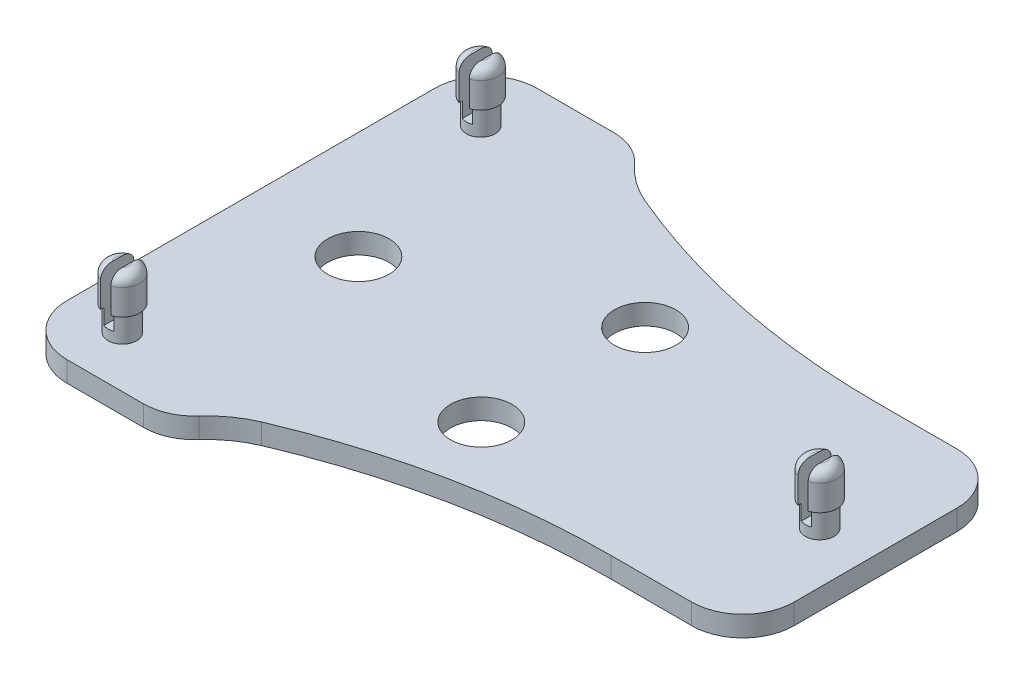
from build123d import *

# Parameters (mm, degrees)
SKETCH1_R           = 1.6
BOSS_EXTRUDE1_DEPTH = 2
FILLET1_R           = 10
FILLET2_R           = 5
SKETCH5_R           = 1.4
BOSS_EXTRUDE6_DEPTH = 6
SKETCH6_R           = 1.7
BOSS_EXTRUDE7_DEPTH = 3.5
FILLET4_R           = 1
FILLET5_R           = 1
SKETCH7_W           = 1
SKETCH7_H           = 5.450379062
SKETCH7_H_2         = 4.683162202
SKETCH7_H_3         = 5.865757262
CUT_EXTRUDE3_DEPTH  = 5
SKETCH8_R           = 1.6
BOSS_EXTRUDE8_DEPTH = 2
SKETCH10_R          = 3
CUT_EXTRUDE4_DEPTH  = 10


with BuildPart() as part:
    # Sketch1 → Boss-Extrude1 (new body)
    with BuildSketch(Plane(origin=(0, 0, 0), x_dir=(1, 0, 0), z_dir=(0, 1, 0))):
        with BuildLine():
            Line((-30.5, -22.95), (-30.5, 22.95))
            Line((-30.5, 22.95), (-15.5, 22.95))
            Line((-15.5, 22.95), (-15.5, 20.95))
            ThreePointArc((-15.5, 20.95), (0.582186133, 14.978356094), (17.616945107, 12.95))
            Line((17.616945107, 12.95), (30.5, 12.95))
            Line((30.5, 12.95), (30.5, -12.95))
            Line((30.5, -12.95), (17.616945107, -12.95))
            ThreePointArc((17.616945107, -12.95), (0.582186133, -14.978356094), (-15.5, -20.95))
            Line((-15.5, -20.95), (-15.5, -22.95))
            Line((-15.5, -22.95), (-30.5, -22.95))
        make_face()
        with Locations(Location((25.5, -0.45, 0), (0, 0, 270))):
            Circle(SKETCH1_R, mode=Mode.SUBTRACT)
    extrude(amount=BOSS_EXTRUDE1_DEPTH)

    # Fillet1
    # the kernel refuses this fillet: 10 mm, written as the material it adds along each edge
    with BuildSketch(Plane(origin=(-15.5, 0, 20.95), x_dir=(0, 0, 1), z_dir=(0, 1, 0))) as fillet1_piece_1:
        with BuildLine():
            CenterArc((6.973239904, 8.675648959), FILLET1_R, 203.002710251, 37.174175757)
            Line((-2.231623793, 4.767902254), (-2.415721067, 4.68974732))
            ThreePointArc((-2.415721067, 4.68974732), (-1.340214661, 2.278919077), (-0.177944953, -0.091299473))
            Line((-0.177944953, -0.091299473), (0, -0.2))
            ThreePointArc((0, -0.2), (1, -0.2), (1.900535202, -0.173512979))
            Line((1.900535202, -0.173512979), (2, 0))
        make_face()
    extrude(amount=2)
    with BuildSketch(Plane(origin=(-15.5, 0, -20.95), x_dir=(0, 0, -1), z_dir=(0, 1, 0))) as fillet1_piece_2:
        with BuildLine():
            CenterArc((6.973239904, -8.675648959), FILLET1_R, 119.823113992, 37.174175757)
            Line((-2.231623793, -4.767902254), (-2.415721067, -4.68974732))
            ThreePointArc((-2.415721067, -4.68974732), (-1.340214661, -2.278919077), (-0.177944953, 0.091299473))
            Line((-0.177944953, 0.091299473), (0, 0.2))
            ThreePointArc((0, 0.2), (1, 0.2), (1.900535202, 0.173512979))
            Line((1.900535202, 0.173512979), (2, 0))
        make_face()
    extrude(amount=2)

    # Fillet2
    fillet2_edges = [part.edges().sort_by_distance(p)[0] for p in [
        (-30.5, 1, 22.95),
        (-30.5, 1, -22.95),
        (-15.5, 1, -22.95),
        (30.5, 1, -12.95),
        (30.5, 1, 12.95),
        (-15.5, 1, 22.95),
    ]]
    fillet(fillet2_edges, radius=FILLET2_R)

    # Sketch5 → Boss-Extrude6 (add)
    with BuildSketch(Plane(origin=(0, 2, 0), x_dir=(1, 0, 0), z_dir=(0, 1, 0))):
        with Locations(Location((-25.1, 17.05, 0), (0, 0, 270))):
            Circle(SKETCH5_R)
        with Locations(Location((-25.1, -17.95, 0), (0, 0, 270))):
            Circle(SKETCH5_R)
        with Locations(Location((25.5, -0.45, 0), (0, 0, 270))):
            Circle(SKETCH5_R)
    extrude(amount=BOSS_EXTRUDE6_DEPTH)


with BuildPart() as boss_extrude6_piece_1:
    # of the separate pieces the step leaves, piece 1, a body of its own (boss_extrude6_pieces)
    add(part.part.solids().sort_by_distance((-14.293829256, 0, -21.274413301))[0])



with BuildPart() as boss_extrude6_piece_2:
    # of the separate pieces the step leaves, piece 2, a body of its own (boss_extrude6_pieces)
    add(part.part.solids().sort_by_distance((25.5, 2, 1.85))[0])


with BuildPart() as boss_extrude6_piece_1_1:
    add(boss_extrude6_piece_1.part)

    add(boss_extrude6_piece_2.part)  # Boss-Extrude7 merges Boss-Extrude6 piece 2
    # Sketch6 → Boss-Extrude7 (add)
    with BuildSketch(Plane(origin=(0, 8, 0), x_dir=(1, 0, 0), z_dir=(0, 1, 0))):
        with Locations(Location((-25.1, 17.05, 0), (0, 0, 270))):
            Circle(SKETCH6_R)
        with Locations(Location((25.5, -0.45, 0), (0, 0, 270))):
            Circle(SKETCH6_R)
        with Locations(Location((-25.1, -17.95, 0), (0, 0, 270))):
            Circle(SKETCH6_R)
    extrude(amount=-BOSS_EXTRUDE7_DEPTH)

    # Fillet4
    fillet4_edges = [boss_extrude6_piece_1_1.edges().sort_by_distance(p)[0] for p in [
        (-25.1, 8, 16.25),
        (-25.1, 8, -18.75),
    ]]
    fillet(fillet4_edges, radius=FILLET4_R)

    # Fillet5
    fillet5_edges = [boss_extrude6_piece_1_1.edges().sort_by_distance(p)[0] for p in [
        (25.5, 8, -1.25),
    ]]
    fillet(fillet5_edges, radius=FILLET5_R)

    # Sketch7 → Cut-Extrude3 (cut)
    with BuildSketch(Plane(origin=(0, 8, 0), x_dir=(1, 0, 0), z_dir=(0, 1, 0))):
        with Locations((-25.1, 17.05)):
            Rectangle(SKETCH7_W, SKETCH7_H)
        with Locations((-25.1, -17.95)):
            Rectangle(SKETCH7_W, SKETCH7_H_2)
        with Locations((25.5, -0.45)):
            Rectangle(SKETCH7_W, SKETCH7_H_3)
    extrude(amount=-CUT_EXTRUDE3_DEPTH, mode=Mode.SUBTRACT)

    # Sketch8 → Boss-Extrude8 (add)
    with BuildSketch(Plane.XZ):
        with Locations((25.5, 0.45)):
            Circle(SKETCH8_R)
    extrude(amount=-BOSS_EXTRUDE8_DEPTH)

    # Sketch10 → Cut-Extrude4 (cut)
    with BuildSketch(Plane(origin=(0, 2, 0), x_dir=(1, 0, 0), z_dir=(0, 1, 0))):
        with Locations(Location((-20, 0, 0), (0, 0, 270))):
            Circle(SKETCH10_R)
        with Locations(Location((0, 8, 0), (0, 0, 270))):
            Circle(SKETCH10_R)
        with Locations(Location((0, -8, 0), (0, 0, 270))):
            Circle(SKETCH10_R)
    extrude(amount=-CUT_EXTRUDE4_DEPTH, mode=Mode.SUBTRACT)


solid = boss_extrude6_piece_1_1.part
